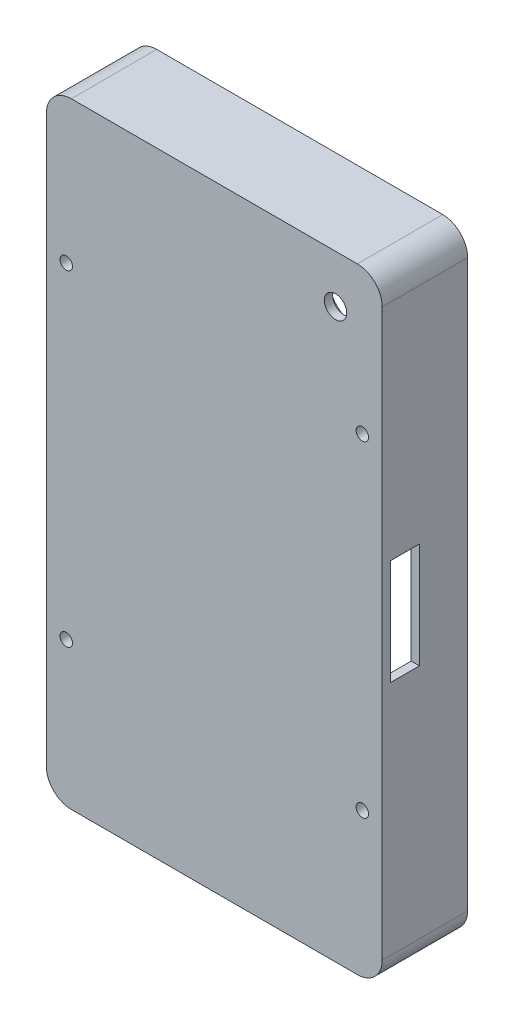
from build123d import *

# Parameters (mm, degrees)
SKIZZE2_W                       = 148.44
SKIZZE2_H                       = 81
AUFSATZ_LINEAR_AUSTRAGEN1_DEPTH = 20.6
VERRUNDUNG2_R                   = 6
WANDUNG2_T                      = -2
VERST_RKUNGSRIPPE11_START       = -18.6
VERST_RKUNGSRIPPE11_OUTLINE_R   = 2.5
VERST_RKUNGSRIPPE11_OUTLINE_R_2 = 1.5
VERST_RKUNGSRIPPE11_DEPTH       = 18.6
VERST_RKUNGSRIPPE17_START       = -3
VERST_RKUNGSRIPPE17_OUTLINE_R   = 7.6
VERST_RKUNGSRIPPE17_OUTLINE_R_2 = 6.6
VERST_RKUNGSRIPPE17_DEPTH       = 3
SKIZZE31_R                      = 2.698446287
SCHNITT_LINEAR_AUSTRAGEN4_DEPTH = 87.572619228
SKIZZE32_R                      = 1.5
SCHNITT_LINEAR_AUSTRAGEN5_DEPTH = 87.572619228
SKIZZE33_W                      = 25.444588161
SKIZZE33_H                      = 6.979087038
SCHNITT_LINEAR_AUSTRAGEN6_DEPTH = 7


# Read off the part's stored shape, not the designer's step: Verstärkungsrippe11, Verstärkungsrippe17
with BuildPart() as part:
    # Skizze2 → Aufsatz-Linear austragen1 (new body)
    with BuildSketch(Plane(origin=(0, 0, 0), x_dir=(0, 1, 0), z_dir=(0, 0, 1))):
        Rectangle(SKIZZE2_W, SKIZZE2_H)
    extrude(amount=AUFSATZ_LINEAR_AUSTRAGEN1_DEPTH)

    # Verrundung2
    verrundung2_edges = [part.edges().sort_by_distance(p)[0] for p in [
        (40.5, 74.22, 10.3),
        (40.5, -74.22, 10.3),
        (-40.5, -74.22, 10.3),
        (-40.5, 74.22, 10.3),
    ]]
    fillet(verrundung2_edges, radius=VERRUNDUNG2_R)

    # Wandung2
    wandung2_openings = [part.faces().sort_by_distance(p)[0] for p in [
        (0, 0, 0),
    ]]
    offset(amount=WANDUNG2_T, openings=wandung2_openings, kind=Kind.INTERSECTION)

    # Verstärkungsrippe11 outline → Verstärkungsrippe11 (add)
    # profile 1 of 4: a face of its own
    with BuildSketch(Plane(origin=(0, 0, 0), x_dir=(1, 0, 0), z_dir=(0, 0, -1)).offset(VERST_RKUNGSRIPPE11_START)):
        with Locations((-35.7, 39.32)):
            Circle(VERST_RKUNGSRIPPE11_OUTLINE_R)
        with Locations((-35.7, 39.32)):
            Circle(VERST_RKUNGSRIPPE11_OUTLINE_R_2, mode=Mode.SUBTRACT)
    # profile 2 of 4: a face of its own
    with BuildSketch(Plane(origin=(0, 0, 0), x_dir=(1, 0, 0), z_dir=(0, 0, -1)).offset(VERST_RKUNGSRIPPE11_START)):
        with Locations((35.7, 39.32)):
            Circle(VERST_RKUNGSRIPPE11_OUTLINE_R)
        with Locations((35.7, 39.32)):
            Circle(VERST_RKUNGSRIPPE11_OUTLINE_R_2, mode=Mode.SUBTRACT)
    # profile 3 of 4: a face of its own
    with BuildSketch(Plane(origin=(0, 0, 0), x_dir=(1, 0, 0), z_dir=(0, 0, -1)).offset(VERST_RKUNGSRIPPE11_START)):
        with Locations((35.7, -39.32)):
            Circle(VERST_RKUNGSRIPPE11_OUTLINE_R)
        with Locations((35.7, -39.32)):
            Circle(VERST_RKUNGSRIPPE11_OUTLINE_R_2, mode=Mode.SUBTRACT)
    # profile 4 of 4: a face of its own
    with BuildSketch(Plane(origin=(0, 0, 0), x_dir=(1, 0, 0), z_dir=(0, 0, -1)).offset(VERST_RKUNGSRIPPE11_START)):
        with Locations((-35.7, -39.32)):
            Circle(VERST_RKUNGSRIPPE11_OUTLINE_R)
        with Locations((-35.7, -39.32)):
            Circle(VERST_RKUNGSRIPPE11_OUTLINE_R_2, mode=Mode.SUBTRACT)
    extrude(amount=VERST_RKUNGSRIPPE11_DEPTH)

    # Verstärkungsrippe17 outline → Verstärkungsrippe17 (add)
    with BuildSketch(Plane.YX.offset(-15.6).offset(VERST_RKUNGSRIPPE17_START)):
        with Locations((62.650739245, 29.243709866)):
            Circle(VERST_RKUNGSRIPPE17_OUTLINE_R)
        with Locations((62.650739245, 29.243709866)):
            Circle(VERST_RKUNGSRIPPE17_OUTLINE_R_2, mode=Mode.SUBTRACT)
    extrude(amount=VERST_RKUNGSRIPPE17_DEPTH)

    # Skizze31 → Schnitt-Linear austragen4 (cut, through all)
    with BuildSketch(Plane(origin=(0, 0, 18.6), x_dir=(1, 0, 0), z_dir=(0, 0, -1))):
        with Locations(Location((29.243709866, -62.650739245, 0), (0, 0, 180))):
            Circle(SKIZZE31_R)
    extrude(amount=-SCHNITT_LINEAR_AUSTRAGEN4_DEPTH, mode=Mode.SUBTRACT)

    # Skizze32 → Schnitt-Linear austragen5 (cut, through all)
    with BuildSketch(Plane(origin=(0, 0, 18.6), x_dir=(1, 0, 0), z_dir=(0, 0, -1))):
        with Locations((-35.7, 39.32)):
            Circle(SKIZZE32_R)
        with Locations((35.7, 39.32)):
            Circle(SKIZZE32_R)
        with Locations((35.7, -39.32)):
            Circle(SKIZZE32_R)
        with Locations((-35.7, -39.32)):
            Circle(SKIZZE32_R)
    extrude(amount=-SCHNITT_LINEAR_AUSTRAGEN5_DEPTH, mode=Mode.SUBTRACT)

    # Skizze33 → Schnitt-Linear austragen6 (cut)
    with BuildSketch(Plane.YZ.offset(40.5)):
        with Locations((1.502294081, 15.110456481)):
            Rectangle(SKIZZE33_W, SKIZZE33_H)
    extrude(amount=-SCHNITT_LINEAR_AUSTRAGEN6_DEPTH, mode=Mode.SUBTRACT)


solid = part.part
